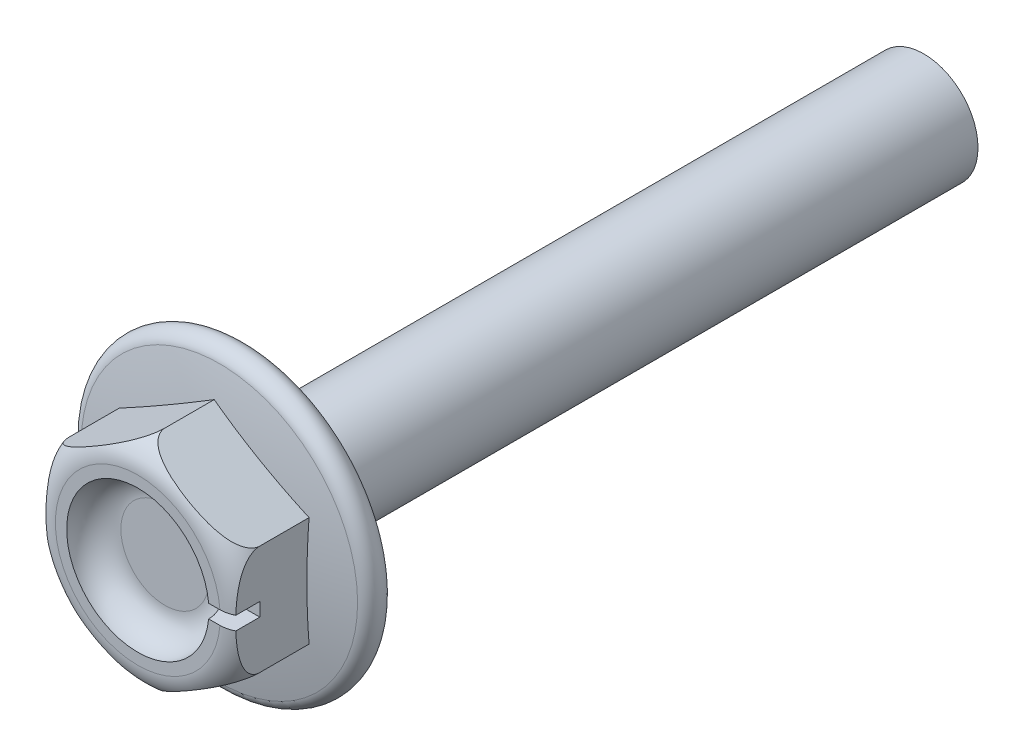
from build123d import *

# Parameters (mm, degrees)
HEAD_DEPTH         = 4
SHANK_SKETCH_R     = 2
SHANK_DEPTH        = 25
SKETCH6_R          = 2.625
HEAD_CUT_DEPTH     = 1
FILLET1_R          = 1
SKETCH7_W          = 3.5
SKETCH7_H          = 0.5
CUT_EXTRUDE1_DEPTH = 1


with BuildPart() as part:
    # Head Sketch → Head (new body)
    with BuildSketch(Plane.XY):
        Polygon((0, 4.041451884), (3.5, 2.020725942), (3.5, -2.020725942), (0, -4.041451884), (-3.5, -2.020725942), (-3.5, 2.020725942), align=None)
    extrude(amount=HEAD_DEPTH)

    # Shank Sketch → Shank (add)
    with BuildSketch(Plane.XY):
        Circle(SHANK_SKETCH_R)
    extrude(amount=-SHANK_DEPTH)

    # Sketch3 → Flange (revolve)
    with BuildSketch(Plane(origin=(0, 0, 0), x_dir=(-1, 0, 0), z_dir=(0, 1, 0)), mode=Mode.PRIVATE) as flange_sk:
        with BuildLine():
            Line((-5, 0), (0, 0))
            Line((0, 0), (0, 1.5))
            ThreePointArc((0, 1.5), (-2.562220765, 1.372207648), (-5.099009901, 0.99009901))
            ThreePointArc((-5.099009901, 0.99009901), (-5.497518595, 0.45024814), (-5, 0))
        make_face()
    revolve(flange_sk.sketch.rotate(Axis((0, 0, 0), (0, 0, 1)), 30), axis=Axis((0, 0, 0), (0, 0, 1)))

    # Sketch5 → Head Trim (revolve, cut)
    with BuildSketch(Plane(origin=(0, 0, 0), x_dir=(0, 0, -1), z_dir=(1, 0, 0)), mode=Mode.PRIVATE) as head_trim_sk:
        with BuildLine():
            Line((-4, -3.041451884), (-4, -4.041451884))
            Line((-4, -4.041451884), (-3, -4.041451884))
            ThreePointArc((-3, -4.041451884), (-3.707106781, -3.748558666), (-4, -3.041451884))
        make_face()
    revolve(head_trim_sk.sketch.rotate(Axis((0, 0, 15.085599173), (0, 0, -1)), 90), axis=Axis((0, 0, 15.085599173), (0, 0, -1)), mode=Mode.SUBTRACT)

    # Sketch6 → Head Cut (cut)
    with BuildSketch(Plane.XY.offset(4)):
        Circle(SKETCH6_R)
    extrude(amount=-HEAD_CUT_DEPTH, mode=Mode.SUBTRACT)

    # Fillet1
    fillet1_edges = [part.edges().sort_by_distance(p)[0] for p in [
        (-2.625, 0, 3),
    ]]
    fillet(fillet1_edges, radius=FILLET1_R - 0.0001)  # a hair under: the kernel refuses the full size

    # Sketch7 → Cut-Extrude1 (cut)
    with BuildSketch(Plane(origin=(0.741825606, 1.407208117, 4), x_dir=(1, 0, 0), z_dir=(0, 0, 1))):
        with Locations((1.008174394, -1.407208117)):
            Rectangle(SKETCH7_W, SKETCH7_H)
    extrude(amount=-CUT_EXTRUDE1_DEPTH, mode=Mode.SUBTRACT)


solid = part.part
